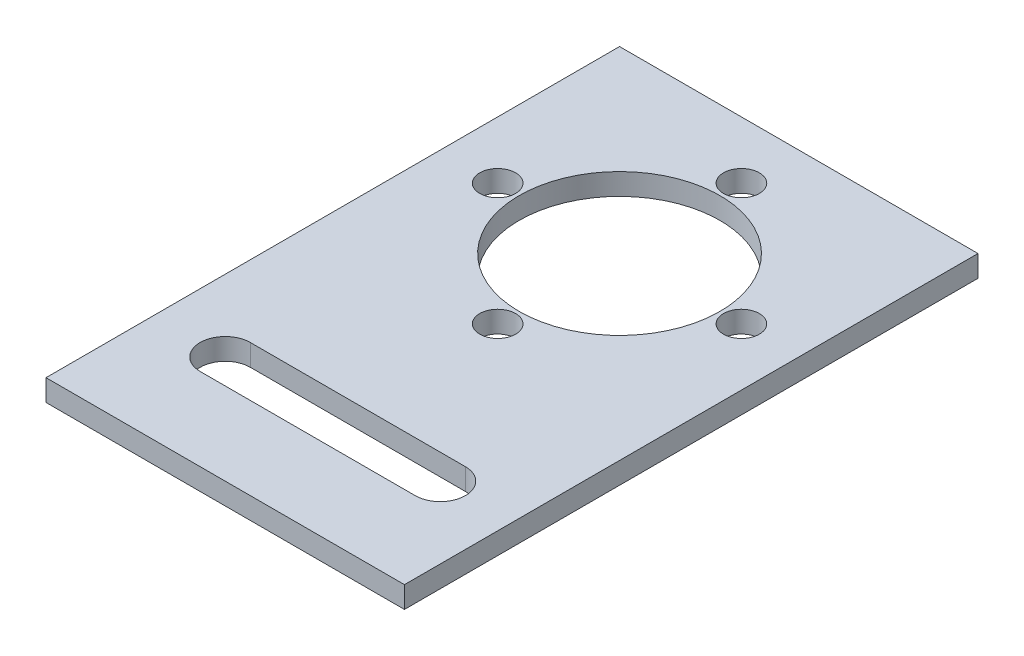
from build123d import *

# Parameters (mm, degrees)
SKETCH1_W           = 50
SKETCH1_H           = 80
SKETCH1_R           = 2.5
SKETCH1_R_2         = 14
BOSS_EXTRUDE1_DEPTH = 3


with BuildPart() as part:
    # Sketch1 → Boss-Extrude1 (new body)
    with BuildSketch(Plane(origin=(0, 0, 0), x_dir=(1, 0, 0), z_dir=(0, 1, 0))):
        Rectangle(SKETCH1_W, SKETCH1_H)
        with Locations((0, 32)):
            Circle(SKETCH1_R, mode=Mode.SUBTRACT)
        with Locations((17, 15)):
            Circle(SKETCH1_R, mode=Mode.SUBTRACT)
        with Locations((0, -2)):
            Circle(SKETCH1_R, mode=Mode.SUBTRACT)
        with Locations((-17, 15)):
            Circle(SKETCH1_R, mode=Mode.SUBTRACT)
        with Locations((0, 15)):
            Circle(SKETCH1_R_2, mode=Mode.SUBTRACT)
        with BuildLine():
            Line((-15, -21.5), (15, -21.5))
            ThreePointArc((15, -21.5), (18.5, -25), (15, -28.5))
            Line((15, -28.5), (-15, -28.5))
            ThreePointArc((-15, -28.5), (-18.5, -25), (-15, -21.5))
        make_face(mode=Mode.SUBTRACT)
    extrude(amount=BOSS_EXTRUDE1_DEPTH)


solid = part.part
